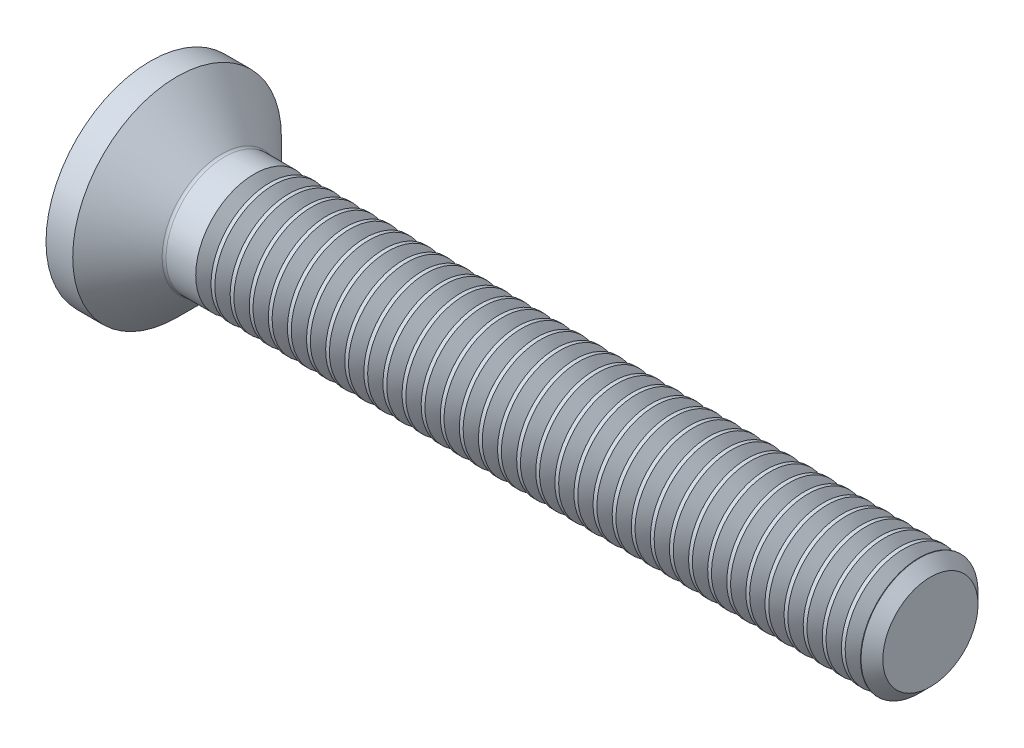
from build123d import *

# Parameters (mm, degrees)
FILLET1_R       = 0.1
HEX_START       = -1.1
HEX_2_DEPTH     = 1.1
THDSCHPAT_COUNT = 35
THDSCHPAT_PITCH = 0.489714286


with BuildPart() as part:
    # BodySke → BaseBody (revolve)
    with BuildSketch(Plane.XY, mode=Mode.PRIVATE) as basebody_sk:
        Polygon((0, 0), (0, 2.675), (0.685, 2.675), (1.86, 1.5), (19.7195, 1.5), (20, 1.2195), (20, 0), align=None)
    revolve(basebody_sk.sketch.rotate(Axis((0, 0, 0), (1, 0, 0)), 90), axis=Axis((0, 0, 0), (1, 0, 0)))

    # Fillet1
    fillet1_edges = [part.edges().sort_by_distance(p)[0] for p in [
        (1.86, 0, -1.5),
    ]]
    fillet(fillet1_edges, radius=FILLET1_R)

    # Hex 2: read off the stored shape, not the designer's step
    # Hex 2 outline → Hex 2 (cut)
    with BuildSketch(Plane.ZY.offset(HEX_START)):
        Polygon((-1, -0.577350269), (0, -1.154700538), (1, -0.577350269), (1, 0.577350269), (0, 1.154700538), (-1, 0.577350269), align=None)
    extrude(amount=HEX_2_DEPTH, mode=Mode.SUBTRACT)

    # Hex 2 2 outline → Hex 2 2 (revolve, cut)
    with BuildSketch(Plane.YX):
        Polygon((1, 1.1), (0, 1.677350269), (0, 1.1), align=None)
    revolve(axis=Axis((0, 0, 0), (1, 0, 0)), mode=Mode.SUBTRACT)

    # ThdSchSke → ThreadSchematic (revolve, cut)
    with BuildSketch(Plane.XY, mode=Mode.PRIVATE) as threadschematic_sk:
        Polygon((2.860001, -1.2195), (2.663592786, -1.5), (2.663592786, -1.875), (3.056409214, -1.875), (3.056409214, -1.5), align=None)
    threadschematic = revolve(threadschematic_sk.sketch.rotate(Axis((-3.175, 0, 0), (1, 0, 0)), 270), axis=Axis((-3.175, 0, 0), (1, 0, 0)), mode=Mode.SUBTRACT)

    # ThdSchPat: ThreadSchematic ×35
    with Locations(*[(i * THDSCHPAT_PITCH, 0, 0) for i in range(1, THDSCHPAT_COUNT)]):
        add(threadschematic, mode=Mode.SUBTRACT)


solid = part.part
